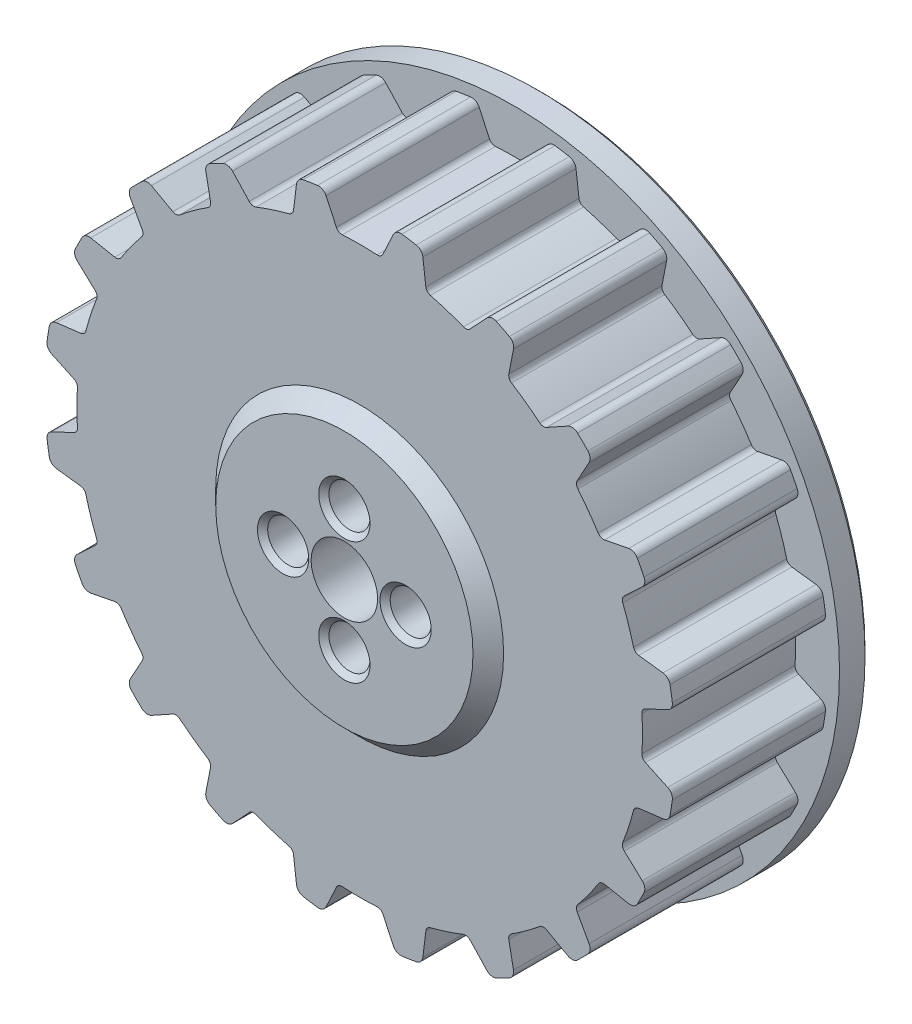
from build123d import *

# Parameters (mm, degrees)
EXTRUDE_1_DEPTH          = 17
PATTERN_CIRCULAR_1_COUNT = 20
SKETCH_4_R               = 32
EXTRUDE_3_DEPTH          = 1
EXTRUDE_START            = 2
SKETCH_5_R               = 32
EXTRUDE_4_DEPTH          = 2
SKETCH_2_R               = 3.25
SKETCH_2_R_2             = 1.6
CUT_EXTRUDE_2_DEPTH      = 49.703182648
EXTRUDE_START_2          = 1.5
SKETCH_6_R               = 12.5
SKETCH_6_R_2             = 1.6
SKETCH_6_R_3             = 3.25
EXTRUDE_5_DEPTH          = 1.5
SKETCH_9_R               = 2.01
CUT_EXTRUDE_4_DEPTH      = 5
CHAMFER_1_SIZE           = 0.5
CHAMFER_2_SIZE           = 1.6
CHAMFER_3_SIZE           = 0.5


with BuildPart() as part:
    # ｽｹｯﾁ1 → ﾎﾞｽ - 押し出し1 (new body)
    with BuildSketch(Plane.XY):
        with BuildLine():
            Line((-2.280607777, 27.993082747), (-3.294991863, 30.16843644))
            ThreePointArc((-3.294991863, 30.16843644), (-3.636319467, 30.532310503), (-4.126882959, 30.623174836))
            ThreePointArc((-4.126882959, 30.623174836), (-4.480653429, 30.573415656), (-4.83382497, 30.519569724))
            Line((-4.83382497, 30.519569724), (-0.782172325, 4.938441703))
            ThreePointArc((-0.782172325, 4.938441703), (0, -5), (0.782172325, 4.938441703))
            Line((0.782172325, 4.938441703), (4.83382497, 30.519569724))
            ThreePointArc((4.83382497, 30.519569724), (4.480653429, 30.573415656), (4.126882959, 30.623174836))
            ThreePointArc((4.126882959, 30.623174836), (3.636319467, 30.532310503), (3.294991863, 30.16843644))
            Line((3.294991863, 30.16843644), (2.280607777, 27.993082747))
            ThreePointArc((2.280607777, 27.993082747), (2.043515441, 27.730960181), (1.7, 27.647784721))
            ThreePointArc((1.7, 27.647784721), (0, 27.7), (-1.7, 27.647784721))
            ThreePointArc((-1.7, 27.647784721), (-2.043515441, 27.730960181), (-2.280607777, 27.993082747))
        make_face()
    extrude_1 = extrude(amount=EXTRUDE_1_DEPTH)

    # 円形ﾊﾟﾀｰﾝ1: ﾎﾞｽ - 押し出し1 ×20 about axis
    pattern_circular_1_axis = Axis((0, 0, 0), (0, 0, 1))
    for i in range(1, PATTERN_CIRCULAR_1_COUNT):
        add(extrude_1.rotate(pattern_circular_1_axis, i * 360 / PATTERN_CIRCULAR_1_COUNT))

    # ｽｹｯﾁ4 → ﾎﾞｽ - 押し出し3 (add)
    with BuildSketch(Plane(origin=(0, 0, 0), x_dir=(-1, 0, 0), z_dir=(0, 0, -1))):
        Circle(SKETCH_4_R)
    extrude(amount=EXTRUDE_3_DEPTH)

    # ｽｹｯﾁ5 → ﾎﾞｽ - 押し出し4 (add)
    with BuildSketch(Plane.XY.offset(EXTRUDE_START)):
        Circle(SKETCH_5_R)
    extrude(amount=-EXTRUDE_4_DEPTH)

    # ｽｹｯﾁ2 → ｶｯﾄ - 押し出し2 (cut, through all)
    with BuildSketch(Plane.XY.offset(17)):
        Circle(SKETCH_2_R)
        with Locations((0, 6)):
            Circle(SKETCH_2_R_2)
        with Locations((6, 0)):
            Circle(SKETCH_2_R_2)
        with Locations((0, -6)):
            Circle(SKETCH_2_R_2)
        with Locations((-6, 0)):
            Circle(SKETCH_2_R_2)
    extrude(amount=-CUT_EXTRUDE_2_DEPTH, mode=Mode.SUBTRACT)

    # ｽｹｯﾁ6 → ﾎﾞｽ - 押し出し5 (add)
    with BuildSketch(Plane.XY.offset(17).offset(EXTRUDE_START_2)):
        Circle(SKETCH_6_R)
        with Locations((0, -6)):
            Circle(SKETCH_6_R_2, mode=Mode.SUBTRACT)
        with Locations((6, 0)):
            Circle(SKETCH_6_R_2, mode=Mode.SUBTRACT)
        with Locations((-6, 0)):
            Circle(SKETCH_6_R_2, mode=Mode.SUBTRACT)
        Circle(SKETCH_6_R_3, mode=Mode.SUBTRACT)
        with Locations((0, 6)):
            Circle(SKETCH_6_R_2, mode=Mode.SUBTRACT)
    extrude(amount=-EXTRUDE_5_DEPTH)

    # ｽｹｯﾁ9 → ｶｯﾄ - 押し出し4 (cut)
    with BuildSketch(Plane.XY.offset(18.5)):
        with Locations((0, 6)):
            Circle(SKETCH_9_R)
        with Locations((6, 0)):
            Circle(SKETCH_9_R)
        with Locations((0, -6)):
            Circle(SKETCH_9_R)
        with Locations((-6, 0)):
            Circle(SKETCH_9_R)
    extrude(amount=-CUT_EXTRUDE_4_DEPTH, mode=Mode.SUBTRACT)

    # 面取り1
    chamfer_1_edges = [part.edges().sort_by_distance(p)[0] for p in [
        (-2.01, 6, 18.5),
        (3.99, 0, 18.5),
        (-2.01, -6, 18.5),
        (-8.01, 0, 18.5),
    ]]
    chamfer(chamfer_1_edges, length=CHAMFER_1_SIZE)

    # 面取り2
    # the kernel refuses this chamfer: 1.6 mm, written as the material it adds along each edge
    with BuildSketch(Plane(origin=(0, 0, 17), x_dir=(1, 0, 0), z_dir=(0, -1, 0))) as chamfer_2_piece_1_section:
        Polygon((12.5, CHAMFER_2_SIZE), (12.5 + CHAMFER_2_SIZE, 0), (12.5, 0), align=None)
    chamfer_2_piece_1 = revolve(axis=Axis((0, 0, 17), (0, 0, 1)), mode=Mode.PRIVATE)
    chamfer_2_piece_1 = split(chamfer_2_piece_1, bisect_by=Plane(origin=(-13.3383239, 0, 18.5), z_dir=(0, 0, -1)), keep=Keep.TOP, mode=Mode.PRIVATE)
    add(chamfer_2_piece_1)

    # 面取り3
    chamfer_3_edges = [part.edges().sort_by_distance(p)[0] for p in [
        (32, 0, -1),
        (-1.6, 6, -1),
        (4.4, 0, -1),
        (-1.6, -6, -1),
        (-7.6, 0, -1),
        (-3.25, 0, -1),
    ]]
    chamfer(chamfer_3_edges, length=CHAMFER_3_SIZE)


solid = part.part
